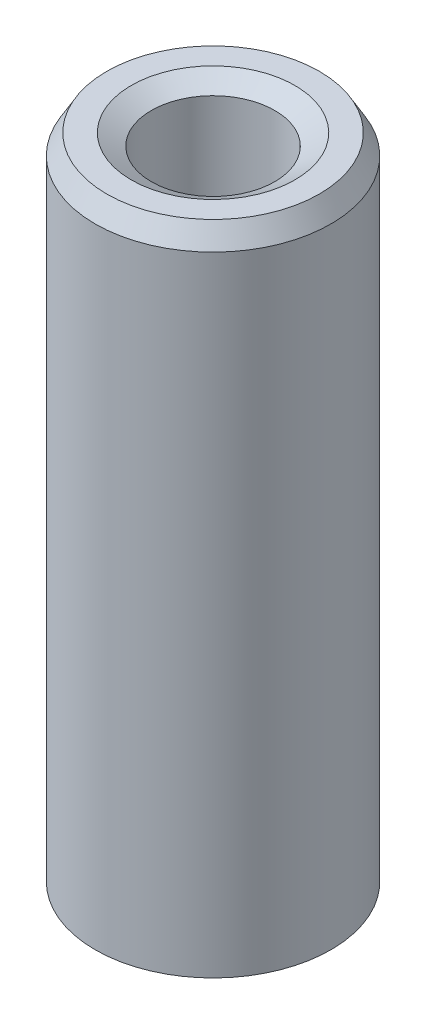
from build123d import *
from OCP.BRepFilletAPI import BRepFilletAPI_MakeChamfer

# Parameters (mm, degrees)
SKETCH1_R           = 15
BOSS_EXTRUDE1_DEPTH = 84.006301673
SKETCH2_R           = 7.85443942
CUT_EXTRUDE1_DEPTH  = 87.643284337
CHAMFER1_SIZE       = 2.557200603
CHAMFER1_SIZE2      = 1.476400457


with BuildPart() as part:
    # Sketch1 → Boss-Extrude1 (new body)
    with BuildSketch(Plane(origin=(0, 0, 0), x_dir=(1, 0, 0), z_dir=(0, 1, 0))):
        Circle(SKETCH1_R)
    extrude(amount=BOSS_EXTRUDE1_DEPTH)

    # Sketch2 → Cut-Extrude1 (cut, through all)
    with BuildSketch(Plane(origin=(0, 0, 0), x_dir=(1, 0, 0), z_dir=(0, 1, 0))):
        Circle(SKETCH2_R)
    extrude(amount=CUT_EXTRUDE1_DEPTH, mode=Mode.SUBTRACT)

    # Chamfer1: one chamfer whose edges measure the first distance from different faces: ONE call of the kernel's chamfer builder (chamfer() names one face for all edges)
    chamfer1_edges_1 = [part.edges().sort_by_distance(p)[0] for p in [
        (-7.85443942, 84.006301673, 0),
    ]]
    chamfer1_side_1 = [part.faces().sort_by_distance(p)[0] for p in [
        (-14.575735931, 84.006301673, 0),
    ]]
    chamfer1_edges_2 = [part.edges().sort_by_distance(p)[0] for p in [
        (-7.85443942, 0, 0),
    ]]
    chamfer1_side_2 = [part.faces().sort_by_distance(p)[0] for p in [
        (-7.85443942, 42.003150836, 0),
    ]]
    chamfer1_edges_3 = [part.edges().sort_by_distance(p)[0] for p in [
        (-15, 0, 0),
    ]]
    chamfer1_side_3 = [part.faces().sort_by_distance(p)[0] for p in [
        (-14.575735931, 0, 0),
    ]]
    chamfer1_edges_4 = [part.edges().sort_by_distance(p)[0] for p in [
        (-15, 84.006301673, 0),
    ]]
    chamfer1_side_4 = [part.faces().sort_by_distance(p)[0] for p in [
        (-15, 42.003150836, 0),
    ]]
    chamfer1 = BRepFilletAPI_MakeChamfer(part.part.solid().wrapped)
    for e in chamfer1_edges_1:
        chamfer1.Add(CHAMFER1_SIZE, CHAMFER1_SIZE2, e.wrapped, chamfer1_side_1[0].wrapped)  # the first distance lies on this face
    for e in chamfer1_edges_2:
        chamfer1.Add(CHAMFER1_SIZE, CHAMFER1_SIZE2, e.wrapped, chamfer1_side_2[0].wrapped)  # the first distance lies on this face
    for e in chamfer1_edges_3:
        chamfer1.Add(CHAMFER1_SIZE, CHAMFER1_SIZE2, e.wrapped, chamfer1_side_3[0].wrapped)  # the first distance lies on this face
    for e in chamfer1_edges_4:
        chamfer1.Add(CHAMFER1_SIZE, CHAMFER1_SIZE2, e.wrapped, chamfer1_side_4[0].wrapped)  # the first distance lies on this face
    add(Compound.cast(chamfer1.Shape()), mode=Mode.REPLACE)


solid = part.part
